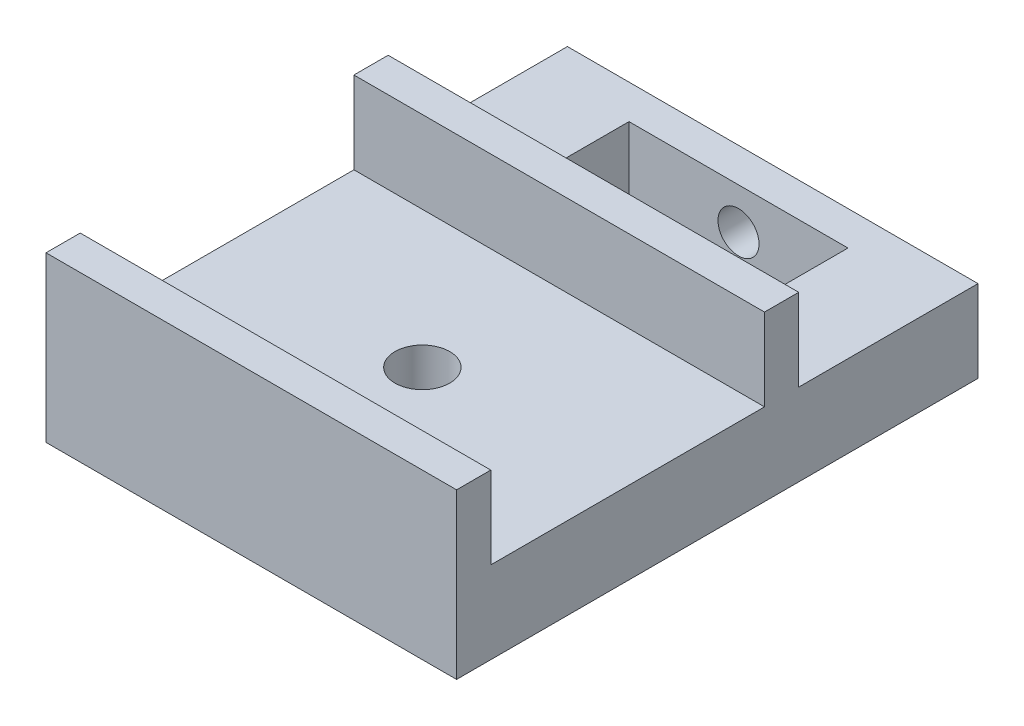
from build123d import *

# Parameters (mm, degrees)
SKETCH1_W           = 30
SKETCH1_H           = 38.1
SKETCH1_W_2         = 16
SKETCH1_H_2         = 10.6
BOSS_EXTRUDE1_DEPTH = 6
SKETCH1_3_W         = 30
SKETCH1_3_H         = 2.5
BOSS_EXTRUDE2_DEPTH = 12
SKETCH3_R           = 1.5
CUT_EXTRUDE2_DEPTH  = 5
CUT_EXTRUDE3_DEPTH  = 2.5
SKETCH2_R           = 2
CUT_EXTRUDE1_DEPTH  = 38.976966704


with BuildPart() as part:
    # Sketch1 → Boss-Extrude1 (new body)
    with BuildSketch(Plane(origin=(0, 0, 0), x_dir=(1, 0, 0), z_dir=(0, 1, 0))):
        with Locations((-15, -3.45)):
            Rectangle(SKETCH1_W, SKETCH1_H)
        with Locations((-15, 7.8)):
            Rectangle(SKETCH1_W_2, SKETCH1_H_2, mode=Mode.SUBTRACT)
    extrude(amount=BOSS_EXTRUDE1_DEPTH)

    # Sketch1<3> → Boss-Extrude2 (add)
    with BuildSketch(Plane(origin=(0, 0, 0), x_dir=(1, 0, 0), z_dir=(0, 1, 0))):
        with Locations((-15, -21.25)):
            Rectangle(SKETCH1_3_W, SKETCH1_3_H)
        with Locations((-15, 1.25)):
            Rectangle(SKETCH1_3_W, SKETCH1_3_H)
    extrude(amount=BOSS_EXTRUDE2_DEPTH)

    # Sketch3 → Cut-Extrude2 (cut)
    with BuildSketch(Plane(origin=(0, 0, -15.6), x_dir=(-1, 0, 0), z_dir=(0, 0, -1))):
        with Locations((15, 3)):
            Circle(SKETCH3_R)
    extrude(amount=-CUT_EXTRUDE2_DEPTH, mode=Mode.SUBTRACT)

    # Sketch4 → Cut-Extrude3 (cut)
    with BuildSketch(Plane(origin=(0, 0, -2.5), x_dir=(-1, 0, 0), z_dir=(0, 0, -1))):
        Polygon((16.443375673, 0.5), (17.886751346, 3), (16.443375673, 5.5), (13.556624327, 5.5), (12.113248654, 3), (13.556624327, 0.5), align=None)
    extrude(amount=-CUT_EXTRUDE3_DEPTH, mode=Mode.SUBTRACT)

    # Sketch2 → Cut-Extrude1 (cut, through all)
    with BuildSketch(Plane(origin=(0, 6, 0), x_dir=(1, 0, 0), z_dir=(0, 1, 0))):
        with Locations((-15, -10)):
            Circle(SKETCH2_R)
    extrude(amount=-CUT_EXTRUDE1_DEPTH, mode=Mode.SUBTRACT)


solid = part.part
